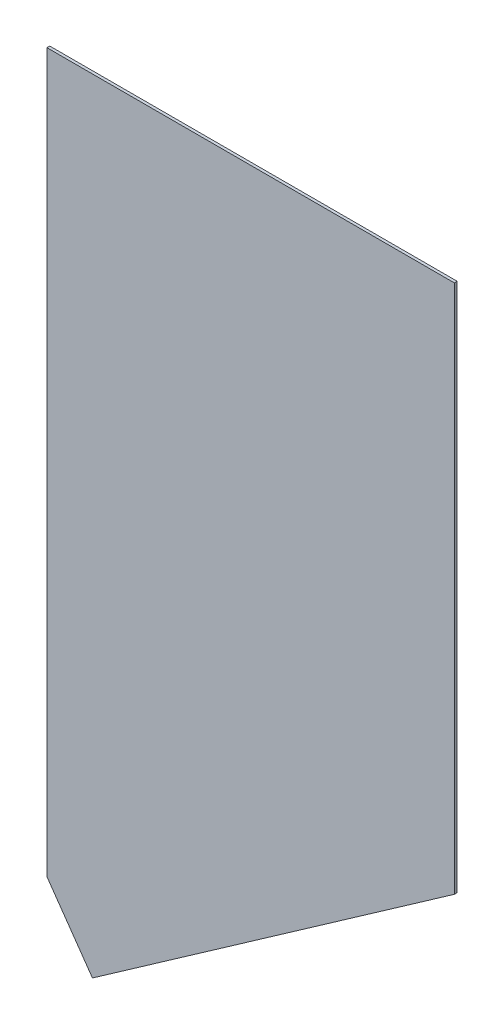
from build123d import *

# Parameters (mm, degrees)
SKETCH1_W           = 304.8
SKETCH1_H           = 635
BOSS_EXTRUDE1_DEPTH = 2.1082
CUT_EXTRUDE1_DEPTH  = 2.1082


with BuildPart() as part:
    # Sketch1 → Boss-Extrude1 (new body)
    with BuildSketch(Plane.XY):
        with Locations((101.6, -317.5)):
            Rectangle(SKETCH1_W, SKETCH1_H)
    extrude(amount=BOSS_EXTRUDE1_DEPTH)

    # Sketch2 → Cut-Extrude1 (cut)
    with BuildSketch(Plane.XY.offset(2.1082)):
        Polygon((-50.8, -537.050081257), (-16.71268836, -585.731807432), (255.723406687, -394.97), (255.723406687, -635), (-50.8, -635), align=None)
    extrude(amount=-CUT_EXTRUDE1_DEPTH, mode=Mode.SUBTRACT)


solid = part.part
